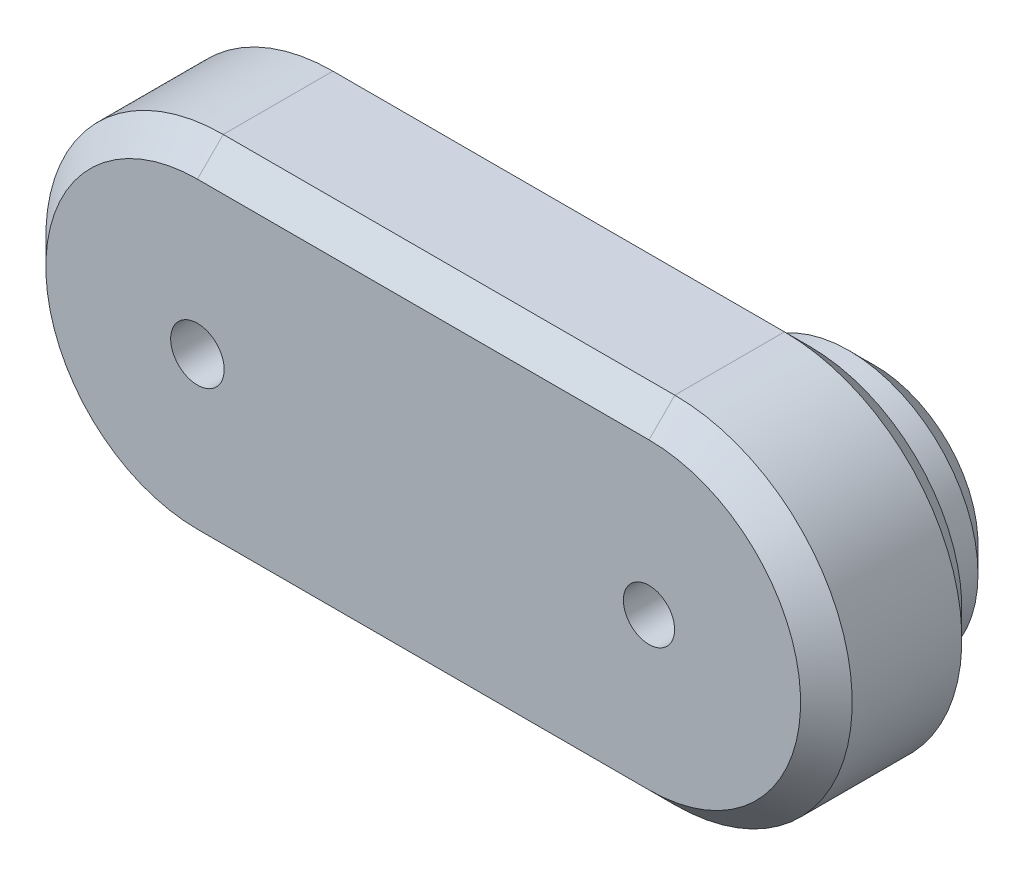
from build123d import *
from build123d.topology import SkipClean

# Parameters (mm, degrees)
SKETCH2_R           = 4.15
SKETCH2_R_2         = 3.96875
BOSS_EXTRUDE1_DEPTH = 25
SKETCH3_R           = 2.25
BOSS_EXTRUDE2_DEPTH = 2.25
CHAMFER1_SIZE       = 1.5
BOSS_EXTRUDE4_START = 10
SKETCH5_R           = 20
SKETCH5_R_2         = 3.96875
BOSS_EXTRUDE4_DEPTH = 10
CHAMFER2_SIZE       = 4
CHAMFER3_SIZE       = 4


with BuildPart() as part:
    # Sketch2 → Boss-Extrude1 (new body)
    with BuildSketch(Plane.XY):
        with BuildLine():
            Line((70, 27.5), (0, 27.5))
            ThreePointArc((0, 27.5), (-27.5, 0), (0, -27.5))
            Line((0, -27.5), (70, -27.5))
            ThreePointArc((70, -27.5), (97.5, 0), (70, 27.5))
        make_face()
        Circle(SKETCH2_R, mode=Mode.SUBTRACT)
        with Locations((70, 0)):
            Circle(SKETCH2_R_2, mode=Mode.SUBTRACT)
    extrude(amount=BOSS_EXTRUDE1_DEPTH)

    # Sketch3 → Boss-Extrude2 (add)
    with BuildSketch(Plane(origin=(0, 0, 0), x_dir=(-1, 0, 0), z_dir=(0, 0, -1))):
        with Locations((-18, 0)):
            Circle(SKETCH3_R)
        with Locations((-16.217439622, 7.809907304)):
            Circle(SKETCH3_R)
        with Locations((-11.222816433, 14.072966684)):
            Circle(SKETCH3_R)
        with Locations((-4.005376811, 17.548702419)):
            Circle(SKETCH3_R)
        with Locations((4.005376811, 17.548702419)):
            Circle(SKETCH3_R)
        with Locations((11.222816433, 14.072966684)):
            Circle(SKETCH3_R)
        with Locations((16.217439622, 7.809907304)):
            Circle(SKETCH3_R)
        with Locations((18, 0)):
            Circle(SKETCH3_R)
        with Locations((16.217439622, -7.809907304)):
            Circle(SKETCH3_R)
        with Locations((11.222816433, -14.072966684)):
            Circle(SKETCH3_R)
        with Locations((4.005376811, -17.548702419)):
            Circle(SKETCH3_R)
        with Locations((-4.005376811, -17.548702419)):
            Circle(SKETCH3_R)
        with Locations((-11.222816433, -14.072966684)):
            Circle(SKETCH3_R)
        with Locations((-16.217439622, -7.809907304)):
            Circle(SKETCH3_R)
    extrude(amount=BOSS_EXTRUDE2_DEPTH)

    # Chamfer1
    chamfer1_edges = [part.edges().sort_by_distance(p)[0] for p in [
        (18.467439622, -7.809907304, -2.25),
        (13.472816433, -14.072966684, -2.25),
        (6.255376811, -17.548702419, -2.25),
        (-1.755376811, -17.548702419, -2.25),
        (-13.967439622, -7.809907304, -2.25),
        (-15.75, 0, -2.25),
        (-13.967439622, 7.809907304, -2.25),
        (-8.972816433, 14.072966684, -2.25),
        (-1.755376811, 17.548702419, -2.25),
        (6.255376811, 17.548702419, -2.25),
        (13.472816433, 14.072966684, -2.25),
        (18.467439622, 7.809907304, -2.25),
        (20.25, 0, -2.25),
        (-8.972816433, -14.072966684, -2.25),
    ]]
    chamfer(chamfer1_edges, length=CHAMFER1_SIZE)

    # Sketch5 → Boss-Extrude4 (add)
    with SkipClean():  # the faces are left unmerged after this step: merging them gives an invalid solid
        with BuildSketch(Plane(origin=(0, 0, 0), x_dir=(-1, 0, 0), z_dir=(0, 0, -1)).offset(BOSS_EXTRUDE4_START)):
            with Locations((-70, 0)):
                Circle(SKETCH5_R)
            with Locations((-70, 0)):
                Circle(SKETCH5_R_2, mode=Mode.SUBTRACT)
        extrude(amount=-BOSS_EXTRUDE4_DEPTH)

    # Chamfer2
    chamfer2_edges = [part.edges().sort_by_distance(p)[0] for p in [
        (90, 0, -10),
    ]]
    chamfer(chamfer2_edges, length=CHAMFER2_SIZE)

    # Chamfer3
    chamfer3_edges = [part.edges().sort_by_distance(p)[0] for p in [
        (-27.5, 0, 25),
        (35, -27.5, 25),
        (35, 27.5, 25),
        (97.5, 0, 25),
        (-27.5, 0, 0),
        (35, -27.5, 0),
        (35, 27.5, 0),
        (97.5, 0, 0),
    ]]
    chamfer(chamfer3_edges, length=CHAMFER3_SIZE)


solid = part.part
